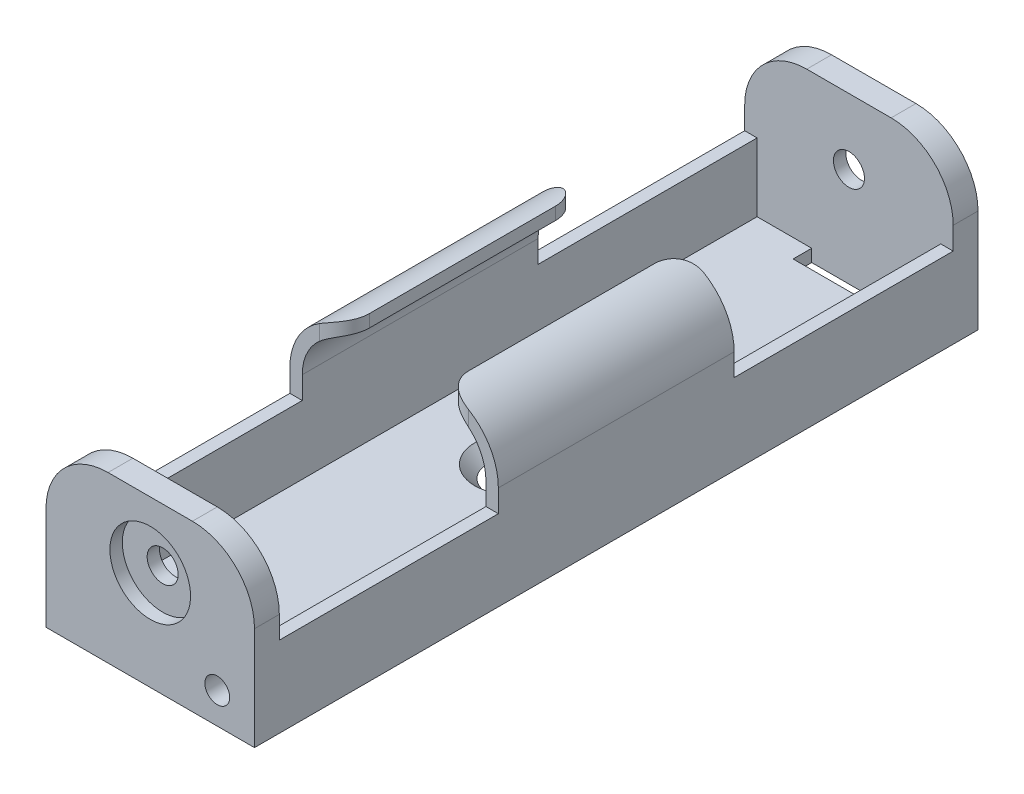
from build123d import *

# Parameters (mm, degrees)
EXTRUDE_1_DEPTH     = 58.3
CUT_EXTRUDE_1_DEPTH = 6.8
CUT_EXTRUDE_2_DEPTH = 54.3
SKETCH_5_R          = 2
CUT_EXTRUDE_4_DEPTH = 55
CHAMFER_2_SIZE      = 1
SKETCH_7_R          = 3.25
CUT_EXTRUDE_5_DEPTH = 1
SKETCH_8_R          = 1.25
CUT_EXTRUDE_6_DEPTH = 10
SKETCH_9_R          = 1
CUT_EXTRUDE_7_DEPTH = 10
SKETCH_11_W         = 6
SKETCH_11_H         = 1.5
CUT_EXTRUDE_8_DEPTH = 10


with BuildPart() as part:
    # Эскиз1 → Бобышка-Вытянуть1 (new body)
    with BuildSketch(Plane.XY):
        with BuildLine():
            Line((-3.4, 9.15), (3.4, 9.15))
            ThreePointArc((3.4, 9.15), (6.935533906, 7.685533906), (8.4, 4.15))
            Line((8.4, 4.15), (8.4, -4.15))
            Line((8.4, -4.15), (-8.4, -4.15))
            Line((-8.4, -4.15), (-8.4, 4.15))
            ThreePointArc((-8.4, 4.15), (-6.935533906, 7.685533906), (-3.4, 9.15))
        make_face()
    extrude(amount=EXTRUDE_1_DEPTH)

    # Эскиз2 → Вырез-Вытянуть1 (cut)
    with BuildSketch(Plane(origin=(0, 9.15, 0), x_dir=(1, 0, 0), z_dir=(0, 1, 0))):
        with BuildLine():
            Line((8.4, -19.65), (8.4, -2))
            Line((8.4, -2), (-8.4, -2))
            Line((-8.4, -2), (-8.4, -19.65))
            Line((-8.4, -19.65), (-6, -19.65))
            ThreePointArc((-6, -19.65), (-4.585786438, -20.235786438), (-4, -21.65))
            Line((-4, -21.65), (-4, -36.65))
            ThreePointArc((-4, -36.65), (-4.585786438, -38.064213562), (-6, -38.65))
            Line((-6, -38.65), (-8.4, -38.65))
            Line((-8.4, -38.65), (-8.4, -56.3))
            Line((-8.4, -56.3), (8.4, -56.3))
            Line((8.4, -56.3), (8.4, -38.65))
            Line((8.4, -38.65), (6, -38.65))
            ThreePointArc((6, -38.65), (4.585786438, -38.064213562), (4, -36.65))
            Line((4, -36.65), (4, -21.65))
            ThreePointArc((4, -21.65), (4.585786438, -20.235786438), (6, -19.65))
            Line((6, -19.65), (8.4, -19.65))
        make_face()
    extrude(amount=-CUT_EXTRUDE_1_DEPTH, mode=Mode.SUBTRACT)

    # Эскиз3 → Вырез-Вытянуть2 (cut)
    with BuildSketch(Plane(origin=(0, 0, 56.3), x_dir=(-1, 0, 0), z_dir=(0, 0, -1))):
        with BuildLine():
            Line((-7.4, 4.15), (-7.4, -3.15))
            Line((-7.4, -3.15), (7.4, -3.15))
            Line((7.4, -3.15), (7.4, 4.15))
            ThreePointArc((7.4, 4.15), (6.228427125, 6.978427125), (3.4, 8.15))
            Line((3.4, 8.15), (-3.4, 8.15))
            ThreePointArc((-3.4, 8.15), (-6.228427125, 6.978427125), (-7.4, 4.15))
        make_face()
    extrude(amount=CUT_EXTRUDE_2_DEPTH, mode=Mode.SUBTRACT)

    # Эскиз5 → Вырез-Вытянуть4 (cut)
    with BuildSketch(Plane(origin=(0, -3.15, 0), x_dir=(1, 0, 0), z_dir=(0, 1, 0))):
        with Locations(Location((0, -29.15, 0), (0, 0, 270))):
            Circle(SKETCH_5_R)
    extrude(amount=-CUT_EXTRUDE_4_DEPTH, mode=Mode.SUBTRACT)

    # Фаска2
    chamfer_2_edges = [part.edges().sort_by_distance(p)[0] for p in [
        (0, -3.15, 27.15),
    ]]
    chamfer(chamfer_2_edges, length=CHAMFER_2_SIZE - 0.0001)  # a hair under: the kernel refuses the full size

    # Эскиз7 → Вырез-Вытянуть5 (cut)
    with BuildSketch(Plane(origin=(0, 0, 0), x_dir=(-1, 0, 0), z_dir=(0, 0, -1))):
        with Locations((0, 3.85)):
            Circle(SKETCH_7_R)
    cut_extrude_5 = extrude(amount=-CUT_EXTRUDE_5_DEPTH, mode=Mode.SUBTRACT)

    # Эскиз8 → Вырез-Вытянуть6 (cut)
    with BuildSketch(Plane(origin=(0, 0, 0), x_dir=(-1, 0, 0), z_dir=(0, 0, -1))):
        with Locations((0, 3.85)):
            Circle(SKETCH_8_R)
    cut_extrude_6 = extrude(amount=-CUT_EXTRUDE_6_DEPTH, mode=Mode.SUBTRACT)

    # Эскиз9 → Вырез-Вытянуть7 (cut)
    with BuildSketch(Plane(origin=(0, 0, 0), x_dir=(-1, 0, 0), z_dir=(0, 0, -1))):
        with Locations((-5.4, -1.65)):
            Circle(SKETCH_9_R)
    cut_extrude_7 = extrude(amount=-CUT_EXTRUDE_7_DEPTH, mode=Mode.SUBTRACT)

    # Эскиз11 → Вырез-Вытянуть8 (cut)
    with BuildSketch(Plane(origin=(0, -3.15, 0), x_dir=(1, 0, 0), z_dir=(0, 1, 0))):
        with Locations((0, -2.75)):
            Rectangle(SKETCH_11_W, SKETCH_11_H)
    cut_extrude_8 = extrude(amount=-CUT_EXTRUDE_8_DEPTH, mode=Mode.SUBTRACT)

    # Зеркальное отражение1: Вырез-Вытянуть5, Вырез-Вытянуть6, Вырез-Вытянуть7, Вырез-Вытянуть8 across plane
    add(cut_extrude_5.mirror(Plane(origin=(0, 0, 29.15), x_dir=(1, 0, 0), z_dir=(0, 0, -1))), mode=Mode.SUBTRACT)
    add(cut_extrude_6.mirror(Plane(origin=(0, 0, 29.15), x_dir=(1, 0, 0), z_dir=(0, 0, -1))), mode=Mode.SUBTRACT)
    add(cut_extrude_7.mirror(Plane(origin=(0, 0, 29.15), x_dir=(1, 0, 0), z_dir=(0, 0, -1))), mode=Mode.SUBTRACT)
    add(cut_extrude_8.mirror(Plane(origin=(0, 0, 29.15), x_dir=(1, 0, 0), z_dir=(0, 0, -1))), mode=Mode.SUBTRACT)


solid = part.part
